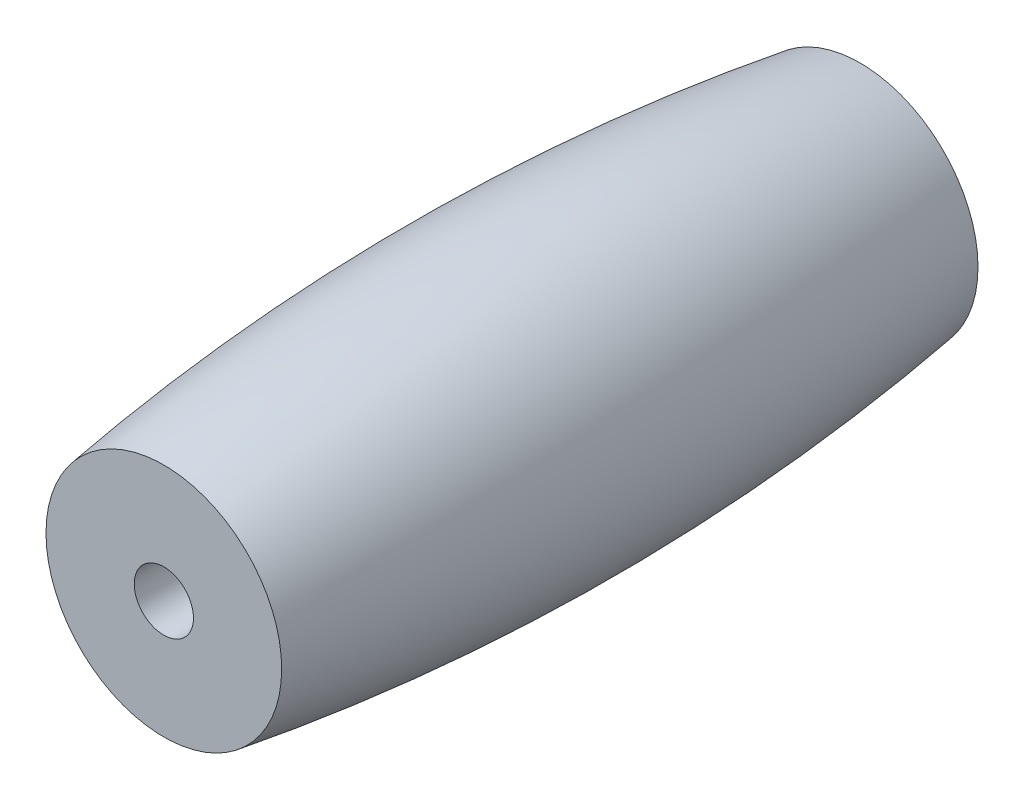
from build123d import *

# Parameters (mm, degrees)
SKETCH3_R          = 2
CUT_EXTRUDE1_DEPTH = 49.970922631


with BuildPart() as part:
    # Sketch2 → Revolve1 (revolve)
    with BuildSketch(Plane(origin=(0, 0, 0), x_dir=(0, 0, -1), z_dir=(1, 0, 0))):
        with BuildLine():
            Line((-23.5, 0), (23.5, 0))
            Line((23.5, 0), (23.5, 7.953950478))
            ThreePointArc((23.5, 7.953950478), (0, 9.725), (-23.5, 7.953950478))
            Line((-23.5, 7.953950478), (-23.5, 0))
        make_face()
    revolve(axis=Axis((0, 0, -25.85), (0, 0, 1)))

    # Sketch3 → Cut-Extrude1 (cut, through all)
    with BuildSketch(Plane.XY.offset(23.5)):
        Circle(SKETCH3_R)
    extrude(amount=-CUT_EXTRUDE1_DEPTH, mode=Mode.SUBTRACT)


solid = part.part
